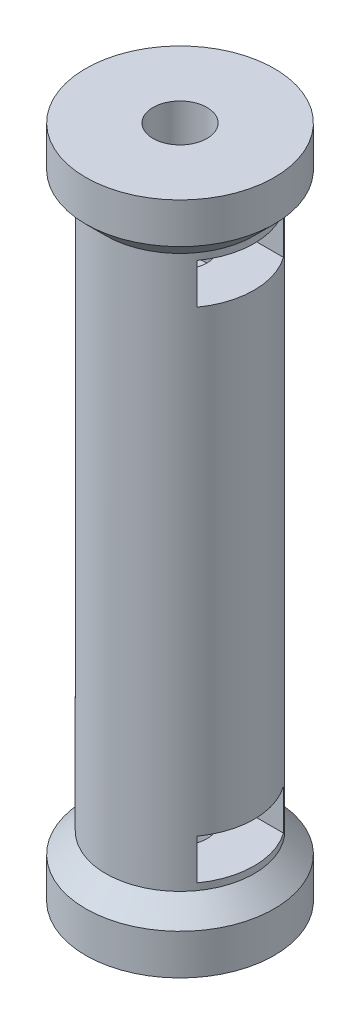
from build123d import *

# Parameters (mm, degrees)
SKETCH1_R           = 5.5
BOSS_EXTRUDE1_DEPTH = 20
SKETCH2_R           = 7
BOSS_EXTRUDE2_DEPTH = 5
CHAMFER2_SIZE       = 2
SKETCH3_R           = 2
CUT_EXTRUDE1_DEPTH  = 10
SKETCH6_W           = 14.643635598
SKETCH6_H           = 6.4
CUT_EXTRUDE2_DEPTH  = 3
CHAMFER4_SIZE       = 1
MIRROR4_START       = -20
MIRROR4_2_DEPTH     = 3
MIRROR4_START_2     = -17
MIRROR4_3_OUTLINE_R = 2
MIRROR4_3_DEPTH     = 2


# Read off the part's stored shape, not the designer's step: Mirror4
with BuildPart() as part:
    # Sketch1 → Boss-Extrude1 (new, symmetric)
    with BuildSketch(Plane(origin=(0, 0, 0), x_dir=(1, 0, 0), z_dir=(0, 1, 0))):
        with Locations(Location((0, 0, 0), (0, 0, 270))):
            Circle(SKETCH1_R)
    extrude(amount=BOSS_EXTRUDE1_DEPTH, both=True)

    # Sketch2 → Boss-Extrude2 (add)
    with BuildSketch(Plane(origin=(0, 20, 0), x_dir=(1, 0, 0), z_dir=(0, 1, 0))):
        with Locations(Location((0, 0, 0), (0, 0, 270))):
            Circle(SKETCH2_R)
    extrude(amount=BOSS_EXTRUDE2_DEPTH)

    # Chamfer2
    # the kernel refuses this chamfer: 2 mm, written as the material it takes off along each edge
    with BuildSketch(Plane(origin=(0, 20, 0), x_dir=(0, 0, 1), z_dir=(-1, 0, 0))) as chamfer2_piece_1_section:
        Polygon((7, CHAMFER2_SIZE), (7 - CHAMFER2_SIZE, 0), (7, 0), align=None)
    chamfer2_piece_1 = revolve(axis=Axis((0, 20, 0), (0, 1, 0)), mode=Mode.PRIVATE)
    chamfer2_piece_1 = chamfer2_piece_1 - Plane(origin=(0, 21.24754516, 0), x_dir=(0, 0, 1), z_dir=(0, 1, 0)) * Cylinder(5.5, 28, mode=Mode.PRIVATE)
    add(chamfer2_piece_1, mode=Mode.SUBTRACT)

    # Sketch3 → Cut-Extrude1 (cut)
    with BuildSketch(Plane(origin=(0, 25, 0), x_dir=(1, 0, 0), z_dir=(0, 1, 0))):
        with Locations(Location((0, 0, 0), (0, 0, 270))):
            Circle(SKETCH3_R)
    extrude(amount=-CUT_EXTRUDE1_DEPTH, mode=Mode.SUBTRACT)

    # Sketch6 → Cut-Extrude2 (cut)
    with BuildSketch(Plane(origin=(0, 20, 0), x_dir=(-1, 0, 0), z_dir=(0, -1, 0))):
        with Locations((-3.821817799, 0)):
            Rectangle(SKETCH6_W, SKETCH6_H)
    extrude(amount=CUT_EXTRUDE2_DEPTH, mode=Mode.SUBTRACT)

    # Chamfer4
    chamfer4_edges = [part.edges().sort_by_distance(p)[0] for p in [
        (-3.5, 18.5, -3.2),
        (-3.5, 18.5, 3.2),
    ]]
    chamfer(chamfer4_edges, length=CHAMFER4_SIZE)

    # Mirror4 outline → Mirror4 (revolve)
    with BuildSketch(Plane.XY):
        Polygon((7, -25), (7, -22), (5.5, -20.5), (5.5, -20), (2, -20), (2, -25), align=None)
    revolve(axis=Axis((0, 0, 0), (0, 1, 0)))

    # Mirror4 2 outline → Mirror4 2 (cut)
    with BuildSketch(Plane(origin=(0, 0, 0), x_dir=(1, 0, 0), z_dir=(0, 1, 0)).offset(MIRROR4_START)):
        with BuildLine():
            Line((4.473253849, 3.2), (-2.5, 3.2))
            Line((-2.5, 3.2), (-3.5, 2.2))
            Line((-3.5, 2.2), (-3.5, -2.2))
            Line((-3.5, -2.2), (-2.5, -3.2))
            Line((-2.5, -3.2), (4.473253849, -3.2))
            ThreePointArc((4.473253849, -3.2), (5.5, 0), (4.473253849, 3.2))
        make_face()
    extrude(amount=MIRROR4_2_DEPTH, mode=Mode.SUBTRACT)

    # Mirror4 3 outline → Mirror4 3 (cut)
    with BuildSketch(Plane(origin=(0, 0, 0), x_dir=(1, 0, 0), z_dir=(0, 1, 0)).offset(MIRROR4_START_2)):
        Circle(MIRROR4_3_OUTLINE_R)
    extrude(amount=MIRROR4_3_DEPTH, mode=Mode.SUBTRACT)


solid = part.part
